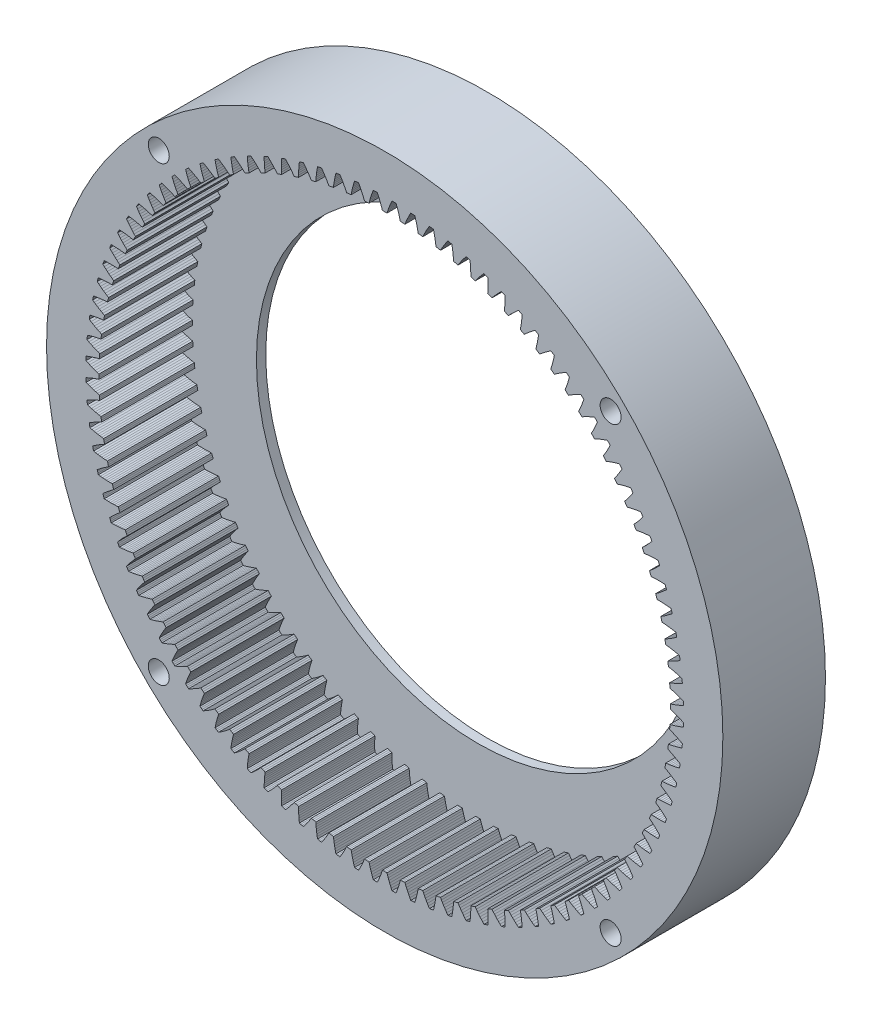
from build123d import *

# Parameters (mm, degrees)
INTERNAL_RING_TEETH_START = 35
SKETCH_1_R                = 72.5
INTERNAL_RING_TEETH_DEPTH = 20
RING_BACK_FLANGE_START    = 33
SKETCH_2_R                = 72.5
SKETCH_2_R_2              = 47.5
RING_BACK_FLANGE_DEPTH    = 2
SKETCH_3_R                = 2.25
THROUGH_HOLES_DEPTH       = 100


with BuildPart() as part:
    # Эскиз1 → Internal_ring_teeth (new body)
    with BuildSketch(Plane.XY.offset(INTERNAL_RING_TEETH_START)):
        Circle(SKETCH_1_R)
        Polygon((64.04305432, -1.578321768), (63.645374415, -1.397447308), (63.247071369, -1.224747848), (62.84819671, -1.060461443), (62.448801879, -0.904864473), (62.048938227, -0.758282244), (61.648657013, -0.62110406), (61.248009405, -0.493805503), (61.249778822, -0.164603419), (61.249778822, 0.164603419), (61.248009405, 0.493805503), (61.648657013, 0.62110406), (62.048938227, 0.758282244), (62.448801879, 0.904864473), (62.84819671, 1.060461443), (63.247071369, 1.224747848), (63.645374415, 1.397447308), (64.04305432, 1.578321768), (64.035270831, 1.867617707), (64.026180537, 2.156875533), (64.015783625, 2.446089343), (63.607531249, 2.60163636), (63.199170274, 2.748985382), (62.790767075, 2.887902058), (62.382390344, 3.018113784), (61.974111757, 3.13929912), (61.566006917, 3.251072749), (61.158156754, 3.35296324), (61.139251909, 3.681626821), (61.11858084, 4.010184045), (61.096144146, 4.338625422), (61.488008024, 4.490829656), (61.878885885, 4.652871015), (62.268756523, 4.824271644), (62.657593225, 5.004639788), (63.045365167, 5.193647558), (63.432038364, 5.39101589), (63.817576338, 5.596503963), (63.791643165, 5.884740314), (63.76440816, 6.172856571), (63.735871879, 6.460846856), (63.318658217, 6.590452558), (62.901850928, 6.711869623), (62.485530969, 6.824868329), (62.069784014, 6.929180925), (61.654701781, 7.024491105), (61.240383919, 7.110419059), (60.826940798, 7.186499369), (60.7874363, 7.513327363), (60.746175743, 7.839938307), (60.703160317, 8.166322767), (61.084693959, 8.342831998), (61.46462585, 8.529097029), (61.842964833, 8.724639618), (62.219708845, 8.929067105), (62.594847712, 9.142050313), (62.968365038, 9.363308595), (63.340239537, 9.592599315), (63.296259027, 9.878638539), (63.250986795, 10.164476165), (63.204423764, 10.450106358), (62.779895369, 10.553259251), (62.356286713, 10.64826518), (61.933693019, 10.734899963), (61.512216604, 10.812901755), (61.091968865, 10.881960633), (60.673073104, 10.941703794), (60.255668696, 10.991673668), (60.195720452, 11.315376233), (60.134033241, 11.638751914), (60.070608847, 11.961791368), (60.440306513, 12.161908993), (60.807793018, 12.371662594), (61.173107215, 12.590575426), (61.5362717, 12.818255475), (61.89729699, 13.054373573), (62.256184342, 13.298648599), (62.612927749, 13.550837059), (62.551073473, 13.833550291), (62.487942682, 14.115981215), (62.423536664, 14.398124065), (61.993368955, 14.474417051), (61.564630722, 14.5426369), (61.137431077, 14.602565851), (60.711888576, 14.653949001), (60.288133858, 14.696484033), (59.866313388, 14.729806622), (59.446594998, 14.753468853), (59.366439595, 15.072768484), (59.284569184, 15.391632684), (59.200986128, 15.710052243), (59.55738879, 15.932988491), (59.910979607, 16.165402859), (60.261827289, 16.406821985), (60.609979004, 16.656856045), (60.955465914, 16.915177184), (61.298306928, 17.181504913), (61.638511339, 17.45559584), (61.559027408, 17.73386734), (61.478287207, 18.011776936), (61.396292383, 18.289318954), (60.962183036, 18.338450939), (60.530007261, 18.379615476), (60.099887626, 18.412602083), (59.671958462, 18.437163805), (59.24636913, 18.453007126), (58.823288683, 18.459777633), (58.402912748, 18.457038836), (58.302866524, 18.770675403), (58.201136016, 19.083769712), (58.097724163, 19.396312719), (58.439425263, 19.641187761), (58.77772493, 19.895345664), (59.112721462, 20.158318313), (59.444486411, 20.429719615), (59.773071463, 20.709224319), (60.098513102, 20.996553676), (60.420835886, 21.291465359), (60.324035986, 21.564196917), (60.226005019, 21.836488402), (60.126744986, 22.108334257), (59.690407232, 22.13011134), (59.256499514, 22.144058106), (58.825157376, 22.149972187), (58.396530389, 22.147615547), (57.97078605, 22.136704629), (57.548115332, 22.116896336), (57.128740883, 22.08776732), (57.009198674, 22.394503042), (56.888009554, 22.70059182), (56.765177023, 23.006024811), (57.090828023, 23.271872237), (57.412501426, 23.546770629), (57.73032473, 23.830258968), (58.044393587, 24.121956415), (58.354780006, 24.421541606), (58.661537901, 24.728738634), (58.964706996, 25.043307191), (58.850973153, 25.309422459), (58.736038304, 25.575021224), (58.619904796, 25.840098065), (58.18306066, 25.834434301), (57.749133435, 25.821108256), (57.318271104, 25.799926469), (56.890637889, 25.770660769), (56.466418761, 25.733038673), (56.04582586, 25.686729753), (55.629107977, 25.631325476), (55.490541563, 25.929949808), (55.350372108, 26.227825062), (55.208603662, 26.524942632), (55.516919367, 26.810713265), (55.820697008, 27.105267248), (56.12009278, 27.408152477), (56.41522606, 27.718994873), (56.706188893, 28.037478226), (56.99305241, 28.363330558), (57.275871347, 28.696314531), (57.145652415, 28.954763275), (57.01426728, 29.212621122), (56.881718622, 29.469882811), (56.446092129, 29.436800553), (56.013857909, 29.396254288), (55.585175802, 29.348060229), (55.160224032, 29.292000966), (54.739204315, 29.227816169), (54.322349119, 29.155189382), (53.909932397, 29.073728501), (53.752888635, 29.363062909), (53.594292031, 29.651549061), (53.434147166, 29.939178624), (53.723910793, 30.243744657), (54.008593801, 30.556791761), (54.288380463, 30.877878531), (54.563413409, 31.206639122), (54.833804358, 31.542763728), (55.099641378, 31.885985375), (55.360994, 32.236070628), (55.214803895, 32.485832867), (55.06748699, 32.73493215), (54.919046291, 32.983363393), (54.48635666, 32.922993201), (54.057521277, 32.855386734), (53.632711206, 32.780370603), (53.212117971, 32.697739017), (52.795959237, 32.607244828), (52.384486884, 32.508586799), (51.977998943, 32.401390802), (51.803097613, 32.680293416), (51.626699767, 32.958251943), (51.448810502, 33.235258355), (51.718878488, 33.557417805), (51.983343348, 33.887722576), (52.24241671, 34.225743705), (52.496263893, 34.571125024), (52.745015849, 34.923564353), (52.988777235, 35.282800774), (53.227632103, 35.648605681), (53.066047769, 35.888695719), (52.903380487, 36.128053357), (52.739633575, 36.366673708), (52.311588433, 36.279253837), (51.887844304, 36.184853978), (51.468582801, 36.08331183), (51.054007991, 35.974434031), (50.644352629, 35.857987588), (50.239887011, 35.733687676), (49.840932073, 35.601179617), (49.648863431, 35.868549734), (49.455360506, 36.134883661), (49.260428888, 36.400173705), (49.509735397, 36.738655156), (49.752938388, 37.084914032), (49.990276006, 37.438535504), (50.221935607, 37.799174489), (50.448066859, 38.166537624), (50.668790596, 38.540371079), (50.884205058, 38.920451974), (50.707864196, 39.149922285), (50.53048851, 39.378593642), (50.35208162, 39.606461377), (49.930370267, 39.492336832), (49.513389716, 39.371516136), (49.101331414, 39.24384871), (48.694411166, 39.109154389), (48.292875897, 38.967215253), (47.897013256, 38.817764012), (47.507165815, 38.66046684), (47.298687868, 38.915249273), (47.088843531, 39.168907502), (46.877638867, 39.421434199), (47.1052, 39.77490182), (47.326181311, 40.135748275), (47.54084652, 40.503574508), (47.749404285, 40.878047881), (47.952022397, 41.258885008), (48.148837389, 41.645840145), (48.339961303, 42.038697024), (48.149559849, 42.256641993), (47.95817578, 42.473724608), (47.765813002, 42.689940437), (47.352099739, 42.549561615), (46.943528399, 42.402796906), (46.540299504, 42.249508048), (46.142639746, 42.089528782), (45.750809248, 41.922657123), (45.365111872, 41.748644368), (44.985910477, 41.567178863), (44.761845992, 41.808368102), (44.536488403, 42.04834956), (44.30984422, 42.287116302), (44.514761898, 42.654175117), (44.712649417, 43.028185056), (44.903795033, 43.408764408), (45.08842788, 43.795594293), (45.266733209, 44.188402421), (45.438862718, 44.586952107), (45.604941805, 44.991034542), (45.401231187, 45.196594041), (45.196594041, 45.401231187), (44.991034542, 45.604941805), (44.586952107, 45.438862718), (44.188402421, 45.266733209), (43.795594293, 45.08842788), (43.408764408, 44.903795033), (43.028185056, 44.712649417), (42.654175117, 44.514761898), (42.287116302, 44.30984422), (42.04834956, 44.536488403), (41.808368102, 44.761845992), (41.567178863, 44.985910477), (41.748644368, 45.365111872), (41.922657123, 45.750809248), (42.089528782, 46.142639746), (42.249508048, 46.540299504), (42.402796906, 46.943528399), (42.549561615, 47.352099739), (42.689940437, 47.765813002), (42.473724608, 47.95817578), (42.256641993, 48.149559849), (42.038697024, 48.339961303), (41.645840145, 48.148837389), (41.258885008, 47.952022397), (40.878047881, 47.749404285), (40.503574508, 47.54084652), (40.135748275, 47.326181311), (39.77490182, 47.1052), (39.421434199, 46.877638867), (39.168907502, 47.088843531), (38.915249273, 47.298687868), (38.66046684, 47.507165815), (38.817764012, 47.897013256), (38.967215253, 48.292875897), (39.109154389, 48.694411166), (39.24384871, 49.101331414), (39.371516136, 49.513389716), (39.492336832, 49.930370267), (39.606461377, 50.35208162), (39.378593642, 50.53048851), (39.149922285, 50.707864196), (38.920451974, 50.884205058), (38.540371079, 50.668790596), (38.166537624, 50.448066859), (37.799174489, 50.221935607), (37.438535504, 49.990276006), (37.084914032, 49.752938388), (36.738655156, 49.509735397), (36.400173705, 49.260428888), (36.134883661, 49.455360506), (35.868549734, 49.648863431), (35.601179617, 49.840932073), (35.733687676, 50.239887011), (35.857987588, 50.644352629), (35.974434031, 51.054007991), (36.08331183, 51.468582801), (36.184853978, 51.887844304), (36.279253837, 52.311588433), (36.366673708, 52.739633575), (36.128053357, 52.903380487), (35.888695719, 53.066047769), (35.648605681, 53.227632103), (35.282800774, 52.988777235), (34.923564353, 52.745015849), (34.571125024, 52.496263893), (34.225743705, 52.24241671), (33.887722576, 51.983343348), (33.557417805, 51.718878488), (33.235258355, 51.448810502), (32.958251943, 51.626699767), (32.680293416, 51.803097613), (32.401390802, 51.977998943), (32.508586799, 52.384486884), (32.607244828, 52.795959237), (32.697739017, 53.212117971), (32.780370603, 53.632711206), (32.855386734, 54.057521277), (32.922993201, 54.48635666), (32.983363393, 54.919046291), (32.73493215, 55.06748699), (32.485832867, 55.214803895), (32.236070628, 55.360994), (31.885985375, 55.099641378), (31.542763728, 54.833804358), (31.206639122, 54.563413409), (30.877878531, 54.288380463), (30.556791761, 54.008593801), (30.243744657, 53.723910793), (29.939178624, 53.434147166), (29.651549061, 53.594292031), (29.363062909, 53.752888635), (29.073728501, 53.909932397), (29.155189382, 54.322349119), (29.227816169, 54.739204315), (29.292000966, 55.160224032), (29.348060229, 55.585175802), (29.396254288, 56.013857909), (29.436800553, 56.446092129), (29.469882811, 56.881718622), (29.212621122, 57.01426728), (28.954763275, 57.145652415), (28.696314531, 57.275871347), (28.363330558, 56.99305241), (28.037478226, 56.706188893), (27.718994873, 56.41522606), (27.408152477, 56.12009278), (27.105267248, 55.820697008), (26.810713265, 55.516919367), (26.524942632, 55.208603662), (26.227825062, 55.350372108), (25.929949808, 55.490541563), (25.631325476, 55.629107977), (25.686729753, 56.04582586), (25.733038673, 56.466418761), (25.770660769, 56.890637889), (25.799926469, 57.318271104), (25.821108256, 57.749133435), (25.834434301, 58.18306066), (25.840098065, 58.619904796), (25.575021224, 58.736038304), (25.309422459, 58.850973153), (25.043307191, 58.964706996), (24.728738634, 58.661537901), (24.421541606, 58.354780006), (24.121956415, 58.044393587), (23.830258968, 57.73032473), (23.546770629, 57.412501426), (23.271872237, 57.090828023), (23.006024811, 56.765177023), (22.70059182, 56.888009554), (22.394503042, 57.009198674), (22.08776732, 57.128740883), (22.116896336, 57.548115332), (22.136704629, 57.97078605), (22.147615547, 58.396530389), (22.149972187, 58.825157376), (22.144058106, 59.256499514), (22.13011134, 59.690407232), (22.108334257, 60.126744986), (21.836488402, 60.226005019), (21.564196917, 60.324035986), (21.291465359, 60.420835886), (20.996553676, 60.098513102), (20.709224319, 59.773071463), (20.429719615, 59.444486411), (20.158318313, 59.112721462), (19.895345664, 58.77772493), (19.641187761, 58.439425263), (19.396312719, 58.097724163), (19.083769712, 58.201136016), (18.770675403, 58.302866524), (18.457038836, 58.402912748), (18.459777633, 58.823288683), (18.453007126, 59.24636913), (18.437163805, 59.671958462), (18.412602083, 60.099887626), (18.379615476, 60.530007261), (18.338450939, 60.962183036), (18.289318954, 61.396292383), (18.011776936, 61.478287207), (17.73386734, 61.559027408), (17.45559584, 61.638511339), (17.181504913, 61.298306928), (16.915177184, 60.955465914), (16.656856045, 60.609979004), (16.406821985, 60.261827289), (16.165402859, 59.910979607), (15.932988491, 59.55738879), (15.710052243, 59.200986128), (15.391632684, 59.284569184), (15.072768484, 59.366439595), (14.753468853, 59.446594998), (14.729806622, 59.866313388), (14.696484033, 60.288133858), (14.653949001, 60.711888576), (14.602565851, 61.137431077), (14.5426369, 61.564630722), (14.474417051, 61.993368955), (14.398124065, 62.423536664), (14.115981215, 62.487942682), (13.833550291, 62.551073473), (13.550837059, 62.612927749), (13.298648599, 62.256184342), (13.054373573, 61.89729699), (12.818255475, 61.5362717), (12.590575426, 61.173107215), (12.371662594, 60.807793018), (12.161908993, 60.440306513), (11.961791368, 60.070608847), (11.638751914, 60.134033241), (11.315376233, 60.195720452), (10.991673668, 60.255668696), (10.941703794, 60.673073104), (10.881960633, 61.091968865), (10.812901755, 61.512216604), (10.734899963, 61.933693019), (10.64826518, 62.356286713), (10.553259251, 62.779895369), (10.450106358, 63.204423764), (10.164476165, 63.250986795), (9.878638539, 63.296259027), (9.592599315, 63.340239537), (9.363308595, 62.968365038), (9.142050313, 62.594847712), (8.929067105, 62.219708845), (8.724639618, 61.842964833), (8.529097029, 61.46462585), (8.342831998, 61.084693959), (8.166322767, 60.703160317), (7.839938307, 60.746175743), (7.513327363, 60.7874363), (7.186499369, 60.826940798), (7.110419059, 61.240383919), (7.024491105, 61.654701781), (6.929180925, 62.069784014), (6.824868329, 62.485530969), (6.711869623, 62.901850928), (6.590452558, 63.318658217), (6.460846856, 63.735871879), (6.172856571, 63.76440816), (5.884740314, 63.791643165), (5.596503963, 63.817576338), (5.39101589, 63.432038364), (5.193647558, 63.045365167), (5.004639788, 62.657593225), (4.824271644, 62.268756523), (4.652871015, 61.878885885), (4.490829656, 61.488008024), (4.338625422, 61.096144146), (4.010184045, 61.11858084), (3.681626821, 61.139251909), (3.35296324, 61.158156754), (3.251072749, 61.566006917), (3.13929912, 61.974111757), (3.018113784, 62.382390344), (2.887902058, 62.790767075), (2.748985382, 63.199170274), (2.60163636, 63.607531249), (2.446089343, 64.015783625), (2.156875533, 64.026180537), (1.867617707, 64.035270831), (1.578321768, 64.04305432), (1.397447308, 63.645374415), (1.224747848, 63.247071369), (1.060461443, 62.84819671), (0.904864473, 62.448801879), (0.758282244, 62.048938227), (0.62110406, 61.648657013), (0.493805503, 61.248009405), (0.164603419, 61.249778822), (-0.164603419, 61.249778822), (-0.493805503, 61.248009405), (-0.62110406, 61.648657013), (-0.758282244, 62.048938227), (-0.904864473, 62.448801879), (-1.060461443, 62.84819671), (-1.224747848, 63.247071369), (-1.397447308, 63.645374415), (-1.578321768, 64.04305432), (-1.867617707, 64.035270831), (-2.156875533, 64.026180537), (-2.446089343, 64.015783625), (-2.60163636, 63.607531249), (-2.748985382, 63.199170274), (-2.887902058, 62.790767075), (-3.018113784, 62.382390344), (-3.13929912, 61.974111757), (-3.251072749, 61.566006917), (-3.35296324, 61.158156754), (-3.681626821, 61.139251909), (-4.010184045, 61.11858084), (-4.338625422, 61.096144146), (-4.490829656, 61.488008024), (-4.652871015, 61.878885885), (-4.824271644, 62.268756523), (-5.004639788, 62.657593225), (-5.193647558, 63.045365167), (-5.39101589, 63.432038364), (-5.596503963, 63.817576338), (-5.884740314, 63.791643165), (-6.172856571, 63.76440816), (-6.460846856, 63.735871879), (-6.590452558, 63.318658217), (-6.711869623, 62.901850928), (-6.824868329, 62.485530969), (-6.929180925, 62.069784014), (-7.024491105, 61.654701781), (-7.110419059, 61.240383919), (-7.186499369, 60.826940798), (-7.513327363, 60.7874363), (-7.839938307, 60.746175743), (-8.166322767, 60.703160317), (-8.342831998, 61.084693959), (-8.529097029, 61.46462585), (-8.724639618, 61.842964833), (-8.929067105, 62.219708845), (-9.142050313, 62.594847712), (-9.363308595, 62.968365038), (-9.592599315, 63.340239537), (-9.878638539, 63.296259027), (-10.164476165, 63.250986795), (-10.450106358, 63.204423764), (-10.553259251, 62.779895369), (-10.64826518, 62.356286713), (-10.734899963, 61.933693019), (-10.812901755, 61.512216604), (-10.881960633, 61.091968865), (-10.941703794, 60.673073104), (-10.991673668, 60.255668696), (-11.315376233, 60.195720452), (-11.638751914, 60.134033241), (-11.961791368, 60.070608847), (-12.161908993, 60.440306513), (-12.371662594, 60.807793018), (-12.590575426, 61.173107215), (-12.818255475, 61.5362717), (-13.054373573, 61.89729699), (-13.298648599, 62.256184342), (-13.550837059, 62.612927749), (-13.833550291, 62.551073473), (-14.115981215, 62.487942682), (-14.398124065, 62.423536664), (-14.474417051, 61.993368955), (-14.5426369, 61.564630722), (-14.602565851, 61.137431077), (-14.653949001, 60.711888576), (-14.696484033, 60.288133858), (-14.729806622, 59.866313388), (-14.753468853, 59.446594998), (-15.072768484, 59.366439595), (-15.391632684, 59.284569184), (-15.710052243, 59.200986128), (-15.932988491, 59.55738879), (-16.165402859, 59.910979607), (-16.406821985, 60.261827289), (-16.656856045, 60.609979004), (-16.915177184, 60.955465914), (-17.181504913, 61.298306928), (-17.45559584, 61.638511339), (-17.73386734, 61.559027408), (-18.011776936, 61.478287207), (-18.289318954, 61.396292383), (-18.338450939, 60.962183036), (-18.379615476, 60.530007261), (-18.412602083, 60.099887626), (-18.437163805, 59.671958462), (-18.453007126, 59.24636913), (-18.459777633, 58.823288683), (-18.457038836, 58.402912748), (-18.770675403, 58.302866524), (-19.083769712, 58.201136016), (-19.396312719, 58.097724163), (-19.641187761, 58.439425263), (-19.895345664, 58.77772493), (-20.158318313, 59.112721462), (-20.429719615, 59.444486411), (-20.709224319, 59.773071463), (-20.996553676, 60.098513102), (-21.291465359, 60.420835886), (-21.564196917, 60.324035986), (-21.836488402, 60.226005019), (-22.108334257, 60.126744986), (-22.13011134, 59.690407232), (-22.144058106, 59.256499514), (-22.149972187, 58.825157376), (-22.147615547, 58.396530389), (-22.136704629, 57.97078605), (-22.116896336, 57.548115332), (-22.08776732, 57.128740883), (-22.394503042, 57.009198674), (-22.70059182, 56.888009554), (-23.006024811, 56.765177023), (-23.271872237, 57.090828023), (-23.546770629, 57.412501426), (-23.830258968, 57.73032473), (-24.121956415, 58.044393587), (-24.421541606, 58.354780006), (-24.728738634, 58.661537901), (-25.043307191, 58.964706996), (-25.309422459, 58.850973153), (-25.575021224, 58.736038304), (-25.840098065, 58.619904796), (-25.834434301, 58.18306066), (-25.821108256, 57.749133435), (-25.799926469, 57.318271104), (-25.770660769, 56.890637889), (-25.733038673, 56.466418761), (-25.686729753, 56.04582586), (-25.631325476, 55.629107977), (-25.929949808, 55.490541563), (-26.227825062, 55.350372108), (-26.524942632, 55.208603662), (-26.810713265, 55.516919367), (-27.105267248, 55.820697008), (-27.408152477, 56.12009278), (-27.718994873, 56.41522606), (-28.037478226, 56.706188893), (-28.363330558, 56.99305241), (-28.696314531, 57.275871347), (-28.954763275, 57.145652415), (-29.212621122, 57.01426728), (-29.469882811, 56.881718622), (-29.436800553, 56.446092129), (-29.396254288, 56.013857909), (-29.348060229, 55.585175802), (-29.292000966, 55.160224032), (-29.227816169, 54.739204315), (-29.155189382, 54.322349119), (-29.073728501, 53.909932397), (-29.363062909, 53.752888635), (-29.651549061, 53.594292031), (-29.939178624, 53.434147166), (-30.243744657, 53.723910793), (-30.556791761, 54.008593801), (-30.877878531, 54.288380463), (-31.206639122, 54.563413409), (-31.542763728, 54.833804358), (-31.885985375, 55.099641378), (-32.236070628, 55.360994), (-32.485832867, 55.214803895), (-32.73493215, 55.06748699), (-32.983363393, 54.919046291), (-32.922993201, 54.48635666), (-32.855386734, 54.057521277), (-32.780370603, 53.632711206), (-32.697739017, 53.212117971), (-32.607244828, 52.795959237), (-32.508586799, 52.384486884), (-32.401390802, 51.977998943), (-32.680293416, 51.803097613), (-32.958251943, 51.626699767), (-33.235258355, 51.448810502), (-33.557417805, 51.718878488), (-33.887722576, 51.983343348), (-34.225743705, 52.24241671), (-34.571125024, 52.496263893), (-34.923564353, 52.745015849), (-35.282800774, 52.988777235), (-35.648605681, 53.227632103), (-35.888695719, 53.066047769), (-36.128053357, 52.903380487), (-36.366673708, 52.739633575), (-36.279253837, 52.311588433), (-36.184853978, 51.887844304), (-36.08331183, 51.468582801), (-35.974434031, 51.054007991), (-35.857987588, 50.644352629), (-35.733687676, 50.239887011), (-35.601179617, 49.840932073), (-35.868549734, 49.648863431), (-36.134883661, 49.455360506), (-36.400173705, 49.260428888), (-36.738655156, 49.509735397), (-37.084914032, 49.752938388), (-37.438535504, 49.990276006), (-37.799174489, 50.221935607), (-38.166537624, 50.448066859), (-38.540371079, 50.668790596), (-38.920451974, 50.884205058), (-39.149922285, 50.707864196), (-39.378593642, 50.53048851), (-39.606461377, 50.35208162), (-39.492336832, 49.930370267), (-39.371516136, 49.513389716), (-39.24384871, 49.101331414), (-39.109154389, 48.694411166), (-38.967215253, 48.292875897), (-38.817764012, 47.897013256), (-38.66046684, 47.507165815), (-38.915249273, 47.298687868), (-39.168907502, 47.088843531), (-39.421434199, 46.877638867), (-39.77490182, 47.1052), (-40.135748275, 47.326181311), (-40.503574508, 47.54084652), (-40.878047881, 47.749404285), (-41.258885008, 47.952022397), (-41.645840145, 48.148837389), (-42.038697024, 48.339961303), (-42.256641993, 48.149559849), (-42.473724608, 47.95817578), (-42.689940437, 47.765813002), (-42.549561615, 47.352099739), (-42.402796906, 46.943528399), (-42.249508048, 46.540299504), (-42.089528782, 46.142639746), (-41.922657123, 45.750809248), (-41.748644368, 45.365111872), (-41.567178863, 44.985910477), (-41.808368102, 44.761845992), (-42.04834956, 44.536488403), (-42.287116302, 44.30984422), (-42.654175117, 44.514761898), (-43.028185056, 44.712649417), (-43.408764408, 44.903795033), (-43.795594293, 45.08842788), (-44.188402421, 45.266733209), (-44.586952107, 45.438862718), (-44.991034542, 45.604941805), (-45.196594041, 45.401231187), (-45.401231187, 45.196594041), (-45.604941805, 44.991034542), (-45.438862718, 44.586952107), (-45.266733209, 44.188402421), (-45.08842788, 43.795594293), (-44.903795033, 43.408764408), (-44.712649417, 43.028185056), (-44.514761898, 42.654175117), (-44.30984422, 42.287116302), (-44.536488403, 42.04834956), (-44.761845992, 41.808368102), (-44.985910477, 41.567178863), (-45.365111872, 41.748644368), (-45.750809248, 41.922657123), (-46.142639746, 42.089528782), (-46.540299504, 42.249508048), (-46.943528399, 42.402796906), (-47.352099739, 42.549561615), (-47.765813002, 42.689940437), (-47.95817578, 42.473724608), (-48.149559849, 42.256641993), (-48.339961303, 42.038697024), (-48.148837389, 41.645840145), (-47.952022397, 41.258885008), (-47.749404285, 40.878047881), (-47.54084652, 40.503574508), (-47.326181311, 40.135748275), (-47.1052, 39.77490182), (-46.877638867, 39.421434199), (-47.088843531, 39.168907502), (-47.298687868, 38.915249273), (-47.507165815, 38.66046684), (-47.897013256, 38.817764012), (-48.292875897, 38.967215253), (-48.694411166, 39.109154389), (-49.101331414, 39.24384871), (-49.513389716, 39.371516136), (-49.930370267, 39.492336832), (-50.35208162, 39.606461377), (-50.53048851, 39.378593642), (-50.707864196, 39.149922285), (-50.884205058, 38.920451974), (-50.668790596, 38.540371079), (-50.448066859, 38.166537624), (-50.221935607, 37.799174489), (-49.990276006, 37.438535504), (-49.752938388, 37.084914032), (-49.509735397, 36.738655156), (-49.260428888, 36.400173705), (-49.455360506, 36.134883661), (-49.648863431, 35.868549734), (-49.840932073, 35.601179617), (-50.239887011, 35.733687676), (-50.644352629, 35.857987588), (-51.054007991, 35.974434031), (-51.468582801, 36.08331183), (-51.887844304, 36.184853978), (-52.311588433, 36.279253837), (-52.739633575, 36.366673708), (-52.903380487, 36.128053357), (-53.066047769, 35.888695719), (-53.227632103, 35.648605681), (-52.988777235, 35.282800774), (-52.745015849, 34.923564353), (-52.496263893, 34.571125024), (-52.24241671, 34.225743705), (-51.983343348, 33.887722576), (-51.718878488, 33.557417805), (-51.448810502, 33.235258355), (-51.626699767, 32.958251943), (-51.803097613, 32.680293416), (-51.977998943, 32.401390802), (-52.384486884, 32.508586799), (-52.795959237, 32.607244828), (-53.212117971, 32.697739017), (-53.632711206, 32.780370603), (-54.057521277, 32.855386734), (-54.48635666, 32.922993201), (-54.919046291, 32.983363393), (-55.06748699, 32.73493215), (-55.214803895, 32.485832867), (-55.360994, 32.236070628), (-55.099641378, 31.885985375), (-54.833804358, 31.542763728), (-54.563413409, 31.206639122), (-54.288380463, 30.877878531), (-54.008593801, 30.556791761), (-53.723910793, 30.243744657), (-53.434147166, 29.939178624), (-53.594292031, 29.651549061), (-53.752888635, 29.363062909), (-53.909932397, 29.073728501), (-54.322349119, 29.155189382), (-54.739204315, 29.227816169), (-55.160224032, 29.292000966), (-55.585175802, 29.348060229), (-56.013857909, 29.396254288), (-56.446092129, 29.436800553), (-56.881718622, 29.469882811), (-57.01426728, 29.212621122), (-57.145652415, 28.954763275), (-57.275871347, 28.696314531), (-56.99305241, 28.363330558), (-56.706188893, 28.037478226), (-56.41522606, 27.718994873), (-56.12009278, 27.408152477), (-55.820697008, 27.105267248), (-55.516919367, 26.810713265), (-55.208603662, 26.524942632), (-55.350372108, 26.227825062), (-55.490541563, 25.929949808), (-55.629107977, 25.631325476), (-56.04582586, 25.686729753), (-56.466418761, 25.733038673), (-56.890637889, 25.770660769), (-57.318271104, 25.799926469), (-57.749133435, 25.821108256), (-58.18306066, 25.834434301), (-58.619904796, 25.840098065), (-58.736038304, 25.575021224), (-58.850973153, 25.309422459), (-58.964706996, 25.043307191), (-58.661537901, 24.728738634), (-58.354780006, 24.421541606), (-58.044393587, 24.121956415), (-57.73032473, 23.830258968), (-57.412501426, 23.546770629), (-57.090828023, 23.271872237), (-56.765177023, 23.006024811), (-56.888009554, 22.70059182), (-57.009198674, 22.394503042), (-57.128740883, 22.08776732), (-57.548115332, 22.116896336), (-57.97078605, 22.136704629), (-58.396530389, 22.147615547), (-58.825157376, 22.149972187), (-59.256499514, 22.144058106), (-59.690407232, 22.13011134), (-60.126744986, 22.108334257), (-60.226005019, 21.836488402), (-60.324035986, 21.564196917), (-60.420835886, 21.291465359), (-60.098513102, 20.996553676), (-59.773071463, 20.709224319), (-59.444486411, 20.429719615), (-59.112721462, 20.158318313), (-58.77772493, 19.895345664), (-58.439425263, 19.641187761), (-58.097724163, 19.396312719), (-58.201136016, 19.083769712), (-58.302866524, 18.770675403), (-58.402912748, 18.457038836), (-58.823288683, 18.459777633), (-59.24636913, 18.453007126), (-59.671958462, 18.437163805), (-60.099887626, 18.412602083), (-60.530007261, 18.379615476), (-60.962183036, 18.338450939), (-61.396292383, 18.289318954), (-61.478287207, 18.011776936), (-61.559027408, 17.73386734), (-61.638511339, 17.45559584), (-61.298306928, 17.181504913), (-60.955465914, 16.915177184), (-60.609979004, 16.656856045), (-60.261827289, 16.406821985), (-59.910979607, 16.165402859), (-59.55738879, 15.932988491), (-59.200986128, 15.710052243), (-59.284569184, 15.391632684), (-59.366439595, 15.072768484), (-59.446594998, 14.753468853), (-59.866313388, 14.729806622), (-60.288133858, 14.696484033), (-60.711888576, 14.653949001), (-61.137431077, 14.602565851), (-61.564630722, 14.5426369), (-61.993368955, 14.474417051), (-62.423536664, 14.398124065), (-62.487942682, 14.115981215), (-62.551073473, 13.833550291), (-62.612927749, 13.550837059), (-62.256184342, 13.298648599), (-61.89729699, 13.054373573), (-61.5362717, 12.818255475), (-61.173107215, 12.590575426), (-60.807793018, 12.371662594), (-60.440306513, 12.161908993), (-60.070608847, 11.961791368), (-60.134033241, 11.638751914), (-60.195720452, 11.315376233), (-60.255668696, 10.991673668), (-60.673073104, 10.941703794), (-61.091968865, 10.881960633), (-61.512216604, 10.812901755), (-61.933693019, 10.734899963), (-62.356286713, 10.64826518), (-62.779895369, 10.553259251), (-63.204423764, 10.450106358), (-63.250986795, 10.164476165), (-63.296259027, 9.878638539), (-63.340239537, 9.592599315), (-62.968365038, 9.363308595), (-62.594847712, 9.142050313), (-62.219708845, 8.929067105), (-61.842964833, 8.724639618), (-61.46462585, 8.529097029), (-61.084693959, 8.342831998), (-60.703160317, 8.166322767), (-60.746175743, 7.839938307), (-60.7874363, 7.513327363), (-60.826940798, 7.186499369), (-61.240383919, 7.110419059), (-61.654701781, 7.024491105), (-62.069784014, 6.929180925), (-62.485530969, 6.824868329), (-62.901850928, 6.711869623), (-63.318658217, 6.590452558), (-63.735871879, 6.460846856), (-63.76440816, 6.172856571), (-63.791643165, 5.884740314), (-63.817576338, 5.596503963), (-63.432038364, 5.39101589), (-63.045365167, 5.193647558), (-62.657593225, 5.004639788), (-62.268756523, 4.824271644), (-61.878885885, 4.652871015), (-61.488008024, 4.490829656), (-61.096144146, 4.338625422), (-61.11858084, 4.010184045), (-61.139251909, 3.681626821), (-61.158156754, 3.35296324), (-61.566006917, 3.251072749), (-61.974111757, 3.13929912), (-62.382390344, 3.018113784), (-62.790767075, 2.887902058), (-63.199170274, 2.748985382), (-63.607531249, 2.60163636), (-64.015783625, 2.446089343), (-64.026180537, 2.156875533), (-64.035270831, 1.867617707), (-64.04305432, 1.578321768), (-63.645374415, 1.397447308), (-63.247071369, 1.224747848), (-62.84819671, 1.060461443), (-62.448801879, 0.904864473), (-62.048938227, 0.758282244), (-61.648657013, 0.62110406), (-61.248009405, 0.493805503), (-61.249778822, 0.164603419), (-61.249778822, -0.164603419), (-61.248009405, -0.493805503), (-61.648657013, -0.62110406), (-62.048938227, -0.758282244), (-62.448801879, -0.904864473), (-62.84819671, -1.060461443), (-63.247071369, -1.224747848), (-63.645374415, -1.397447308), (-64.04305432, -1.578321768), (-64.035270831, -1.867617707), (-64.026180537, -2.156875533), (-64.015783625, -2.446089343), (-63.607531249, -2.60163636), (-63.199170274, -2.748985382), (-62.790767075, -2.887902058), (-62.382390344, -3.018113784), (-61.974111757, -3.13929912), (-61.566006917, -3.251072749), (-61.158156754, -3.35296324), (-61.139251909, -3.681626821), (-61.11858084, -4.010184045), (-61.096144146, -4.338625422), (-61.488008024, -4.490829656), (-61.878885885, -4.652871015), (-62.268756523, -4.824271644), (-62.657593225, -5.004639788), (-63.045365167, -5.193647558), (-63.432038364, -5.39101589), (-63.817576338, -5.596503963), (-63.791643165, -5.884740314), (-63.76440816, -6.172856571), (-63.735871879, -6.460846856), (-63.318658217, -6.590452558), (-62.901850928, -6.711869623), (-62.485530969, -6.824868329), (-62.069784014, -6.929180925), (-61.654701781, -7.024491105), (-61.240383919, -7.110419059), (-60.826940798, -7.186499369), (-60.7874363, -7.513327363), (-60.746175743, -7.839938307), (-60.703160317, -8.166322767), (-61.084693959, -8.342831998), (-61.46462585, -8.529097029), (-61.842964833, -8.724639618), (-62.219708845, -8.929067105), (-62.594847712, -9.142050313), (-62.968365038, -9.363308595), (-63.340239537, -9.592599315), (-63.296259027, -9.878638539), (-63.250986795, -10.164476165), (-63.204423764, -10.450106358), (-62.779895369, -10.553259251), (-62.356286713, -10.64826518), (-61.933693019, -10.734899963), (-61.512216604, -10.812901755), (-61.091968865, -10.881960633), (-60.673073104, -10.941703794), (-60.255668696, -10.991673668), (-60.195720452, -11.315376233), (-60.134033241, -11.638751914), (-60.070608847, -11.961791368), (-60.440306513, -12.161908993), (-60.807793018, -12.371662594), (-61.173107215, -12.590575426), (-61.5362717, -12.818255475), (-61.89729699, -13.054373573), (-62.256184342, -13.298648599), (-62.612927749, -13.550837059), (-62.551073473, -13.833550291), (-62.487942682, -14.115981215), (-62.423536664, -14.398124065), (-61.993368955, -14.474417051), (-61.564630722, -14.5426369), (-61.137431077, -14.602565851), (-60.711888576, -14.653949001), (-60.288133858, -14.696484033), (-59.866313388, -14.729806622), (-59.446594998, -14.753468853), (-59.366439595, -15.072768484), (-59.284569184, -15.391632684), (-59.200986128, -15.710052243), (-59.55738879, -15.932988491), (-59.910979607, -16.165402859), (-60.261827289, -16.406821985), (-60.609979004, -16.656856045), (-60.955465914, -16.915177184), (-61.298306928, -17.181504913), (-61.638511339, -17.45559584), (-61.559027408, -17.73386734), (-61.478287207, -18.011776936), (-61.396292383, -18.289318954), (-60.962183036, -18.338450939), (-60.530007261, -18.379615476), (-60.099887626, -18.412602083), (-59.671958462, -18.437163805), (-59.24636913, -18.453007126), (-58.823288683, -18.459777633), (-58.402912748, -18.457038836), (-58.302866524, -18.770675403), (-58.201136016, -19.083769712), (-58.097724163, -19.396312719), (-58.439425263, -19.641187761), (-58.77772493, -19.895345664), (-59.112721462, -20.158318313), (-59.444486411, -20.429719615), (-59.773071463, -20.709224319), (-60.098513102, -20.996553676), (-60.420835886, -21.291465359), (-60.324035986, -21.564196917), (-60.226005019, -21.836488402), (-60.126744986, -22.108334257), (-59.690407232, -22.13011134), (-59.256499514, -22.144058106), (-58.825157376, -22.149972187), (-58.396530389, -22.147615547), (-57.97078605, -22.136704629), (-57.548115332, -22.116896336), (-57.128740883, -22.08776732), (-57.009198674, -22.394503042), (-56.888009554, -22.70059182), (-56.765177023, -23.006024811), (-57.090828023, -23.271872237), (-57.412501426, -23.546770629), (-57.73032473, -23.830258968), (-58.044393587, -24.121956415), (-58.354780006, -24.421541606), (-58.661537901, -24.728738634), (-58.964706996, -25.043307191), (-58.850973153, -25.309422459), (-58.736038304, -25.575021224), (-58.619904796, -25.840098065), (-58.18306066, -25.834434301), (-57.749133435, -25.821108256), (-57.318271104, -25.799926469), (-56.890637889, -25.770660769), (-56.466418761, -25.733038673), (-56.04582586, -25.686729753), (-55.629107977, -25.631325476), (-55.490541563, -25.929949808), (-55.350372108, -26.227825062), (-55.208603662, -26.524942632), (-55.516919367, -26.810713265), (-55.820697008, -27.105267248), (-56.12009278, -27.408152477), (-56.41522606, -27.718994873), (-56.706188893, -28.037478226), (-56.99305241, -28.363330558), (-57.275871347, -28.696314531), (-57.145652415, -28.954763275), (-57.01426728, -29.212621122), (-56.881718622, -29.469882811), (-56.446092129, -29.436800553), (-56.013857909, -29.396254288), (-55.585175802, -29.348060229), (-55.160224032, -29.292000966), (-54.739204315, -29.227816169), (-54.322349119, -29.155189382), (-53.909932397, -29.073728501), (-53.752888635, -29.363062909), (-53.594292031, -29.651549061), (-53.434147166, -29.939178624), (-53.723910793, -30.243744657), (-54.008593801, -30.556791761), (-54.288380463, -30.877878531), (-54.563413409, -31.206639122), (-54.833804358, -31.542763728), (-55.099641378, -31.885985375), (-55.360994, -32.236070628), (-55.214803895, -32.485832867), (-55.06748699, -32.73493215), (-54.919046291, -32.983363393), (-54.48635666, -32.922993201), (-54.057521277, -32.855386734), (-53.632711206, -32.780370603), (-53.212117971, -32.697739017), (-52.795959237, -32.607244828), (-52.384486884, -32.508586799), (-51.977998943, -32.401390802), (-51.803097613, -32.680293416), (-51.626699767, -32.958251943), (-51.448810502, -33.235258355), (-51.718878488, -33.557417805), (-51.983343348, -33.887722576), (-52.24241671, -34.225743705), (-52.496263893, -34.571125024), (-52.745015849, -34.923564353), (-52.988777235, -35.282800774), (-53.227632103, -35.648605681), (-53.066047769, -35.888695719), (-52.903380487, -36.128053357), (-52.739633575, -36.366673708), (-52.311588433, -36.279253837), (-51.887844304, -36.184853978), (-51.468582801, -36.08331183), (-51.054007991, -35.974434031), (-50.644352629, -35.857987588), (-50.239887011, -35.733687676), (-49.840932073, -35.601179617), (-49.648863431, -35.868549734), (-49.455360506, -36.134883661), (-49.260428888, -36.400173705), (-49.509735397, -36.738655156), (-49.752938388, -37.084914032), (-49.990276006, -37.438535504), (-50.221935607, -37.799174489), (-50.448066859, -38.166537624), (-50.668790596, -38.540371079), (-50.884205058, -38.920451974), (-50.707864196, -39.149922285), (-50.53048851, -39.378593642), (-50.35208162, -39.606461377), (-49.930370267, -39.492336832), (-49.513389716, -39.371516136), (-49.101331414, -39.24384871), (-48.694411166, -39.109154389), (-48.292875897, -38.967215253), (-47.897013256, -38.817764012), (-47.507165815, -38.66046684), (-47.298687868, -38.915249273), (-47.088843531, -39.168907502), (-46.877638867, -39.421434199), (-47.1052, -39.77490182), (-47.326181311, -40.135748275), (-47.54084652, -40.503574508), (-47.749404285, -40.878047881), (-47.952022397, -41.258885008), (-48.148837389, -41.645840145), (-48.339961303, -42.038697024), (-48.149559849, -42.256641993), (-47.95817578, -42.473724608), (-47.765813002, -42.689940437), (-47.352099739, -42.549561615), (-46.943528399, -42.402796906), (-46.540299504, -42.249508048), (-46.142639746, -42.089528782), (-45.750809248, -41.922657123), (-45.365111872, -41.748644368), (-44.985910477, -41.567178863), (-44.761845992, -41.808368102), (-44.536488403, -42.04834956), (-44.30984422, -42.287116302), (-44.514761898, -42.654175117), (-44.712649417, -43.028185056), (-44.903795033, -43.408764408), (-45.08842788, -43.795594293), (-45.266733209, -44.188402421), (-45.438862718, -44.586952107), (-45.604941805, -44.991034542), (-45.401231187, -45.196594041), (-45.196594041, -45.401231187), (-44.991034542, -45.604941805), (-44.586952107, -45.438862718), (-44.188402421, -45.266733209), (-43.795594293, -45.08842788), (-43.408764408, -44.903795033), (-43.028185056, -44.712649417), (-42.654175117, -44.514761898), (-42.287116302, -44.30984422), (-42.04834956, -44.536488403), (-41.808368102, -44.761845992), (-41.567178863, -44.985910477), (-41.748644368, -45.365111872), (-41.922657123, -45.750809248), (-42.089528782, -46.142639746), (-42.249508048, -46.540299504), (-42.402796906, -46.943528399), (-42.549561615, -47.352099739), (-42.689940437, -47.765813002), (-42.473724608, -47.95817578), (-42.256641993, -48.149559849), (-42.038697024, -48.339961303), (-41.645840145, -48.148837389), (-41.258885008, -47.952022397), (-40.878047881, -47.749404285), (-40.503574508, -47.54084652), (-40.135748275, -47.326181311), (-39.77490182, -47.1052), (-39.421434199, -46.877638867), (-39.168907502, -47.088843531), (-38.915249273, -47.298687868), (-38.66046684, -47.507165815), (-38.817764012, -47.897013256), (-38.967215253, -48.292875897), (-39.109154389, -48.694411166), (-39.24384871, -49.101331414), (-39.371516136, -49.513389716), (-39.492336832, -49.930370267), (-39.606461377, -50.35208162), (-39.378593642, -50.53048851), (-39.149922285, -50.707864196), (-38.920451974, -50.884205058), (-38.540371079, -50.668790596), (-38.166537624, -50.448066859), (-37.799174489, -50.221935607), (-37.438535504, -49.990276006), (-37.084914032, -49.752938388), (-36.738655156, -49.509735397), (-36.400173705, -49.260428888), (-36.134883661, -49.455360506), (-35.868549734, -49.648863431), (-35.601179617, -49.840932073), (-35.733687676, -50.239887011), (-35.857987588, -50.644352629), (-35.974434031, -51.054007991), (-36.08331183, -51.468582801), (-36.184853978, -51.887844304), (-36.279253837, -52.311588433), (-36.366673708, -52.739633575), (-36.128053357, -52.903380487), (-35.888695719, -53.066047769), (-35.648605681, -53.227632103), (-35.282800774, -52.988777235), (-34.923564353, -52.745015849), (-34.571125024, -52.496263893), (-34.225743705, -52.24241671), (-33.887722576, -51.983343348), (-33.557417805, -51.718878488), (-33.235258355, -51.448810502), (-32.958251943, -51.626699767), (-32.680293416, -51.803097613), (-32.401390802, -51.977998943), (-32.508586799, -52.384486884), (-32.607244828, -52.795959237), (-32.697739017, -53.212117971), (-32.780370603, -53.632711206), (-32.855386734, -54.057521277), (-32.922993201, -54.48635666), (-32.983363393, -54.919046291), (-32.73493215, -55.06748699), (-32.485832867, -55.214803895), (-32.236070628, -55.360994), (-31.885985375, -55.099641378), (-31.542763728, -54.833804358), (-31.206639122, -54.563413409), (-30.877878531, -54.288380463), (-30.556791761, -54.008593801), (-30.243744657, -53.723910793), (-29.939178624, -53.434147166), (-29.651549061, -53.594292031), (-29.363062909, -53.752888635), (-29.073728501, -53.909932397), (-29.155189382, -54.322349119), (-29.227816169, -54.739204315), (-29.292000966, -55.160224032), (-29.348060229, -55.585175802), (-29.396254288, -56.013857909), (-29.436800553, -56.446092129), (-29.469882811, -56.881718622), (-29.212621122, -57.01426728), (-28.954763275, -57.145652415), (-28.696314531, -57.275871347), (-28.363330558, -56.99305241), (-28.037478226, -56.706188893), (-27.718994873, -56.41522606), (-27.408152477, -56.12009278), (-27.105267248, -55.820697008), (-26.810713265, -55.516919367), (-26.524942632, -55.208603662), (-26.227825062, -55.350372108), (-25.929949808, -55.490541563), (-25.631325476, -55.629107977), (-25.686729753, -56.04582586), (-25.733038673, -56.466418761), (-25.770660769, -56.890637889), (-25.799926469, -57.318271104), (-25.821108256, -57.749133435), (-25.834434301, -58.18306066), (-25.840098065, -58.619904796), (-25.575021224, -58.736038304), (-25.309422459, -58.850973153), (-25.043307191, -58.964706996), (-24.728738634, -58.661537901), (-24.421541606, -58.354780006), (-24.121956415, -58.044393587), (-23.830258968, -57.73032473), (-23.546770629, -57.412501426), (-23.271872237, -57.090828023), (-23.006024811, -56.765177023), (-22.70059182, -56.888009554), (-22.394503042, -57.009198674), (-22.08776732, -57.128740883), (-22.116896336, -57.548115332), (-22.136704629, -57.97078605), (-22.147615547, -58.396530389), (-22.149972187, -58.825157376), (-22.144058106, -59.256499514), (-22.13011134, -59.690407232), (-22.108334257, -60.126744986), (-21.836488402, -60.226005019), (-21.564196917, -60.324035986), (-21.291465359, -60.420835886), (-20.996553676, -60.098513102), (-20.709224319, -59.773071463), (-20.429719615, -59.444486411), (-20.158318313, -59.112721462), (-19.895345664, -58.77772493), (-19.641187761, -58.439425263), (-19.396312719, -58.097724163), (-19.083769712, -58.201136016), (-18.770675403, -58.302866524), (-18.457038836, -58.402912748), (-18.459777633, -58.823288683), (-18.453007126, -59.24636913), (-18.437163805, -59.671958462), (-18.412602083, -60.099887626), (-18.379615476, -60.530007261), (-18.338450939, -60.962183036), (-18.289318954, -61.396292383), (-18.011776936, -61.478287207), (-17.73386734, -61.559027408), (-17.45559584, -61.638511339), (-17.181504913, -61.298306928), (-16.915177184, -60.955465914), (-16.656856045, -60.609979004), (-16.406821985, -60.261827289), (-16.165402859, -59.910979607), (-15.932988491, -59.55738879), (-15.710052243, -59.200986128), (-15.391632684, -59.284569184), (-15.072768484, -59.366439595), (-14.753468853, -59.446594998), (-14.729806622, -59.866313388), (-14.696484033, -60.288133858), (-14.653949001, -60.711888576), (-14.602565851, -61.137431077), (-14.5426369, -61.564630722), (-14.474417051, -61.993368955), (-14.398124065, -62.423536664), (-14.115981215, -62.487942682), (-13.833550291, -62.551073473), (-13.550837059, -62.612927749), (-13.298648599, -62.256184342), (-13.054373573, -61.89729699), (-12.818255475, -61.5362717), (-12.590575426, -61.173107215), (-12.371662594, -60.807793018), (-12.161908993, -60.440306513), (-11.961791368, -60.070608847), (-11.638751914, -60.134033241), (-11.315376233, -60.195720452), (-10.991673668, -60.255668696), (-10.941703794, -60.673073104), (-10.881960633, -61.091968865), (-10.812901755, -61.512216604), (-10.734899963, -61.933693019), (-10.64826518, -62.356286713), (-10.553259251, -62.779895369), (-10.450106358, -63.204423764), (-10.164476165, -63.250986795), (-9.878638539, -63.296259027), (-9.592599315, -63.340239537), (-9.363308595, -62.968365038), (-9.142050313, -62.594847712), (-8.929067105, -62.219708845), (-8.724639618, -61.842964833), (-8.529097029, -61.46462585), (-8.342831998, -61.084693959), (-8.166322767, -60.703160317), (-7.839938307, -60.746175743), (-7.513327363, -60.7874363), (-7.186499369, -60.826940798), (-7.110419059, -61.240383919), (-7.024491105, -61.654701781), (-6.929180925, -62.069784014), (-6.824868329, -62.485530969), (-6.711869623, -62.901850928), (-6.590452558, -63.318658217), (-6.460846856, -63.735871879), (-6.172856571, -63.76440816), (-5.884740314, -63.791643165), (-5.596503963, -63.817576338), (-5.39101589, -63.432038364), (-5.193647558, -63.045365167), (-5.004639788, -62.657593225), (-4.824271644, -62.268756523), (-4.652871015, -61.878885885), (-4.490829656, -61.488008024), (-4.338625422, -61.096144146), (-4.010184045, -61.11858084), (-3.681626821, -61.139251909), (-3.35296324, -61.158156754), (-3.251072749, -61.566006917), (-3.13929912, -61.974111757), (-3.018113784, -62.382390344), (-2.887902058, -62.790767075), (-2.748985382, -63.199170274), (-2.60163636, -63.607531249), (-2.446089343, -64.015783625), (-2.156875533, -64.026180537), (-1.867617707, -64.035270831), (-1.578321768, -64.04305432), (-1.397447308, -63.645374415), (-1.224747848, -63.247071369), (-1.060461443, -62.84819671), (-0.904864473, -62.448801879), (-0.758282244, -62.048938227), (-0.62110406, -61.648657013), (-0.493805503, -61.248009405), (-0.164603419, -61.249778822), (0.164603419, -61.249778822), (0.493805503, -61.248009405), (0.62110406, -61.648657013), (0.758282244, -62.048938227), (0.904864473, -62.448801879), (1.060461443, -62.84819671), (1.224747848, -63.247071369), (1.397447308, -63.645374415), (1.578321768, -64.04305432), (1.867617707, -64.035270831), (2.156875533, -64.026180537), (2.446089343, -64.015783625), (2.60163636, -63.607531249), (2.748985382, -63.199170274), (2.887902058, -62.790767075), (3.018113784, -62.382390344), (3.13929912, -61.974111757), (3.251072749, -61.566006917), (3.35296324, -61.158156754), (3.681626821, -61.139251909), (4.010184045, -61.11858084), (4.338625422, -61.096144146), (4.490829656, -61.488008024), (4.652871015, -61.878885885), (4.824271644, -62.268756523), (5.004639788, -62.657593225), (5.193647558, -63.045365167), (5.39101589, -63.432038364), (5.596503963, -63.817576338), (5.884740314, -63.791643165), (6.172856571, -63.76440816), (6.460846856, -63.735871879), (6.590452558, -63.318658217), (6.711869623, -62.901850928), (6.824868329, -62.485530969), (6.929180925, -62.069784014), (7.024491105, -61.654701781), (7.110419059, -61.240383919), (7.186499369, -60.826940798), (7.513327363, -60.7874363), (7.839938307, -60.746175743), (8.166322767, -60.703160317), (8.342831998, -61.084693959), (8.529097029, -61.46462585), (8.724639618, -61.842964833), (8.929067105, -62.219708845), (9.142050313, -62.594847712), (9.363308595, -62.968365038), (9.592599315, -63.340239537), (9.878638539, -63.296259027), (10.164476165, -63.250986795), (10.450106358, -63.204423764), (10.553259251, -62.779895369), (10.64826518, -62.356286713), (10.734899963, -61.933693019), (10.812901755, -61.512216604), (10.881960633, -61.091968865), (10.941703794, -60.673073104), (10.991673668, -60.255668696), (11.315376233, -60.195720452), (11.638751914, -60.134033241), (11.961791368, -60.070608847), (12.161908993, -60.440306513), (12.371662594, -60.807793018), (12.590575426, -61.173107215), (12.818255475, -61.5362717), (13.054373573, -61.89729699), (13.298648599, -62.256184342), (13.550837059, -62.612927749), (13.833550291, -62.551073473), (14.115981215, -62.487942682), (14.398124065, -62.423536664), (14.474417051, -61.993368955), (14.5426369, -61.564630722), (14.602565851, -61.137431077), (14.653949001, -60.711888576), (14.696484033, -60.288133858), (14.729806622, -59.866313388), (14.753468853, -59.446594998), (15.072768484, -59.366439595), (15.391632684, -59.284569184), (15.710052243, -59.200986128), (15.932988491, -59.55738879), (16.165402859, -59.910979607), (16.406821985, -60.261827289), (16.656856045, -60.609979004), (16.915177184, -60.955465914), (17.181504913, -61.298306928), (17.45559584, -61.638511339), (17.73386734, -61.559027408), (18.011776936, -61.478287207), (18.289318954, -61.396292383), (18.338450939, -60.962183036), (18.379615476, -60.530007261), (18.412602083, -60.099887626), (18.437163805, -59.671958462), (18.453007126, -59.24636913), (18.459777633, -58.823288683), (18.457038836, -58.402912748), (18.770675403, -58.302866524), (19.083769712, -58.201136016), (19.396312719, -58.097724163), (19.641187761, -58.439425263), (19.895345664, -58.77772493), (20.158318313, -59.112721462), (20.429719615, -59.444486411), (20.709224319, -59.773071463), (20.996553676, -60.098513102), (21.291465359, -60.420835886), (21.564196917, -60.324035986), (21.836488402, -60.226005019), (22.108334257, -60.126744986), (22.13011134, -59.690407232), (22.144058106, -59.256499514), (22.149972187, -58.825157376), (22.147615547, -58.396530389), (22.136704629, -57.97078605), (22.116896336, -57.548115332), (22.08776732, -57.128740883), (22.394503042, -57.009198674), (22.70059182, -56.888009554), (23.006024811, -56.765177023), (23.271872237, -57.090828023), (23.546770629, -57.412501426), (23.830258968, -57.73032473), (24.121956415, -58.044393587), (24.421541606, -58.354780006), (24.728738634, -58.661537901), (25.043307191, -58.964706996), (25.309422459, -58.850973153), (25.575021224, -58.736038304), (25.840098065, -58.619904796), (25.834434301, -58.18306066), (25.821108256, -57.749133435), (25.799926469, -57.318271104), (25.770660769, -56.890637889), (25.733038673, -56.466418761), (25.686729753, -56.04582586), (25.631325476, -55.629107977), (25.929949808, -55.490541563), (26.227825062, -55.350372108), (26.524942632, -55.208603662), (26.810713265, -55.516919367), (27.105267248, -55.820697008), (27.408152477, -56.12009278), (27.718994873, -56.41522606), (28.037478226, -56.706188893), (28.363330558, -56.99305241), (28.696314531, -57.275871347), (28.954763275, -57.145652415), (29.212621122, -57.01426728), (29.469882811, -56.881718622), (29.436800553, -56.446092129), (29.396254288, -56.013857909), (29.348060229, -55.585175802), (29.292000966, -55.160224032), (29.227816169, -54.739204315), (29.155189382, -54.322349119), (29.073728501, -53.909932397), (29.363062909, -53.752888635), (29.651549061, -53.594292031), (29.939178624, -53.434147166), (30.243744657, -53.723910793), (30.556791761, -54.008593801), (30.877878531, -54.288380463), (31.206639122, -54.563413409), (31.542763728, -54.833804358), (31.885985375, -55.099641378), (32.236070628, -55.360994), (32.485832867, -55.214803895), (32.73493215, -55.06748699), (32.983363393, -54.919046291), (32.922993201, -54.48635666), (32.855386734, -54.057521277), (32.780370603, -53.632711206), (32.697739017, -53.212117971), (32.607244828, -52.795959237), (32.508586799, -52.384486884), (32.401390802, -51.977998943), (32.680293416, -51.803097613), (32.958251943, -51.626699767), (33.235258355, -51.448810502), (33.557417805, -51.718878488), (33.887722576, -51.983343348), (34.225743705, -52.24241671), (34.571125024, -52.496263893), (34.923564353, -52.745015849), (35.282800774, -52.988777235), (35.648605681, -53.227632103), (35.888695719, -53.066047769), (36.128053357, -52.903380487), (36.366673708, -52.739633575), (36.279253837, -52.311588433), (36.184853978, -51.887844304), (36.08331183, -51.468582801), (35.974434031, -51.054007991), (35.857987588, -50.644352629), (35.733687676, -50.239887011), (35.601179617, -49.840932073), (35.868549734, -49.648863431), (36.134883661, -49.455360506), (36.400173705, -49.260428888), (36.738655156, -49.509735397), (37.084914032, -49.752938388), (37.438535504, -49.990276006), (37.799174489, -50.221935607), (38.166537624, -50.448066859), (38.540371079, -50.668790596), (38.920451974, -50.884205058), (39.149922285, -50.707864196), (39.378593642, -50.53048851), (39.606461377, -50.35208162), (39.492336832, -49.930370267), (39.371516136, -49.513389716), (39.24384871, -49.101331414), (39.109154389, -48.694411166), (38.967215253, -48.292875897), (38.817764012, -47.897013256), (38.66046684, -47.507165815), (38.915249273, -47.298687868), (39.168907502, -47.088843531), (39.421434199, -46.877638867), (39.77490182, -47.1052), (40.135748275, -47.326181311), (40.503574508, -47.54084652), (40.878047881, -47.749404285), (41.258885008, -47.952022397), (41.645840145, -48.148837389), (42.038697024, -48.339961303), (42.256641993, -48.149559849), (42.473724608, -47.95817578), (42.689940437, -47.765813002), (42.549561615, -47.352099739), (42.402796906, -46.943528399), (42.249508048, -46.540299504), (42.089528782, -46.142639746), (41.922657123, -45.750809248), (41.748644368, -45.365111872), (41.567178863, -44.985910477), (41.808368102, -44.761845992), (42.04834956, -44.536488403), (42.287116302, -44.30984422), (42.654175117, -44.514761898), (43.028185056, -44.712649417), (43.408764408, -44.903795033), (43.795594293, -45.08842788), (44.188402421, -45.266733209), (44.586952107, -45.438862718), (44.991034542, -45.604941805), (45.196594041, -45.401231187), (45.401231187, -45.196594041), (45.604941805, -44.991034542), (45.438862718, -44.586952107), (45.266733209, -44.188402421), (45.08842788, -43.795594293), (44.903795033, -43.408764408), (44.712649417, -43.028185056), (44.514761898, -42.654175117), (44.30984422, -42.287116302), (44.536488403, -42.04834956), (44.761845992, -41.808368102), (44.985910477, -41.567178863), (45.365111872, -41.748644368), (45.750809248, -41.922657123), (46.142639746, -42.089528782), (46.540299504, -42.249508048), (46.943528399, -42.402796906), (47.352099739, -42.549561615), (47.765813002, -42.689940437), (47.95817578, -42.473724608), (48.149559849, -42.256641993), (48.339961303, -42.038697024), (48.148837389, -41.645840145), (47.952022397, -41.258885008), (47.749404285, -40.878047881), (47.54084652, -40.503574508), (47.326181311, -40.135748275), (47.1052, -39.77490182), (46.877638867, -39.421434199), (47.088843531, -39.168907502), (47.298687868, -38.915249273), (47.507165815, -38.66046684), (47.897013256, -38.817764012), (48.292875897, -38.967215253), (48.694411166, -39.109154389), (49.101331414, -39.24384871), (49.513389716, -39.371516136), (49.930370267, -39.492336832), (50.35208162, -39.606461377), (50.53048851, -39.378593642), (50.707864196, -39.149922285), (50.884205058, -38.920451974), (50.668790596, -38.540371079), (50.448066859, -38.166537624), (50.221935607, -37.799174489), (49.990276006, -37.438535504), (49.752938388, -37.084914032), (49.509735397, -36.738655156), (49.260428888, -36.400173705), (49.455360506, -36.134883661), (49.648863431, -35.868549734), (49.840932073, -35.601179617), (50.239887011, -35.733687676), (50.644352629, -35.857987588), (51.054007991, -35.974434031), (51.468582801, -36.08331183), (51.887844304, -36.184853978), (52.311588433, -36.279253837), (52.739633575, -36.366673708), (52.903380487, -36.128053357), (53.066047769, -35.888695719), (53.227632103, -35.648605681), (52.988777235, -35.282800774), (52.745015849, -34.923564353), (52.496263893, -34.571125024), (52.24241671, -34.225743705), (51.983343348, -33.887722576), (51.718878488, -33.557417805), (51.448810502, -33.235258355), (51.626699767, -32.958251943), (51.803097613, -32.680293416), (51.977998943, -32.401390802), (52.384486884, -32.508586799), (52.795959237, -32.607244828), (53.212117971, -32.697739017), (53.632711206, -32.780370603), (54.057521277, -32.855386734), (54.48635666, -32.922993201), (54.919046291, -32.983363393), (55.06748699, -32.73493215), (55.214803895, -32.485832867), (55.360994, -32.236070628), (55.099641378, -31.885985375), (54.833804358, -31.542763728), (54.563413409, -31.206639122), (54.288380463, -30.877878531), (54.008593801, -30.556791761), (53.723910793, -30.243744657), (53.434147166, -29.939178624), (53.594292031, -29.651549061), (53.752888635, -29.363062909), (53.909932397, -29.073728501), (54.322349119, -29.155189382), (54.739204315, -29.227816169), (55.160224032, -29.292000966), (55.585175802, -29.348060229), (56.013857909, -29.396254288), (56.446092129, -29.436800553), (56.881718622, -29.469882811), (57.01426728, -29.212621122), (57.145652415, -28.954763275), (57.275871347, -28.696314531), (56.99305241, -28.363330558), (56.706188893, -28.037478226), (56.41522606, -27.718994873), (56.12009278, -27.408152477), (55.820697008, -27.105267248), (55.516919367, -26.810713265), (55.208603662, -26.524942632), (55.350372108, -26.227825062), (55.490541563, -25.929949808), (55.629107977, -25.631325476), (56.04582586, -25.686729753), (56.466418761, -25.733038673), (56.890637889, -25.770660769), (57.318271104, -25.799926469), (57.749133435, -25.821108256), (58.18306066, -25.834434301), (58.619904796, -25.840098065), (58.736038304, -25.575021224), (58.850973153, -25.309422459), (58.964706996, -25.043307191), (58.661537901, -24.728738634), (58.354780006, -24.421541606), (58.044393587, -24.121956415), (57.73032473, -23.830258968), (57.412501426, -23.546770629), (57.090828023, -23.271872237), (56.765177023, -23.006024811), (56.888009554, -22.70059182), (57.009198674, -22.394503042), (57.128740883, -22.08776732), (57.548115332, -22.116896336), (57.97078605, -22.136704629), (58.396530389, -22.147615547), (58.825157376, -22.149972187), (59.256499514, -22.144058106), (59.690407232, -22.13011134), (60.126744986, -22.108334257), (60.226005019, -21.836488402), (60.324035986, -21.564196917), (60.420835886, -21.291465359), (60.098513102, -20.996553676), (59.773071463, -20.709224319), (59.444486411, -20.429719615), (59.112721462, -20.158318313), (58.77772493, -19.895345664), (58.439425263, -19.641187761), (58.097724163, -19.396312719), (58.201136016, -19.083769712), (58.302866524, -18.770675403), (58.402912748, -18.457038836), (58.823288683, -18.459777633), (59.24636913, -18.453007126), (59.671958462, -18.437163805), (60.099887626, -18.412602083), (60.530007261, -18.379615476), (60.962183036, -18.338450939), (61.396292383, -18.289318954), (61.478287207, -18.011776936), (61.559027408, -17.73386734), (61.638511339, -17.45559584), (61.298306928, -17.181504913), (60.955465914, -16.915177184), (60.609979004, -16.656856045), (60.261827289, -16.406821985), (59.910979607, -16.165402859), (59.55738879, -15.932988491), (59.200986128, -15.710052243), (59.284569184, -15.391632684), (59.366439595, -15.072768484), (59.446594998, -14.753468853), (59.866313388, -14.729806622), (60.288133858, -14.696484033), (60.711888576, -14.653949001), (61.137431077, -14.602565851), (61.564630722, -14.5426369), (61.993368955, -14.474417051), (62.423536664, -14.398124065), (62.487942682, -14.115981215), (62.551073473, -13.833550291), (62.612927749, -13.550837059), (62.256184342, -13.298648599), (61.89729699, -13.054373573), (61.5362717, -12.818255475), (61.173107215, -12.590575426), (60.807793018, -12.371662594), (60.440306513, -12.161908993), (60.070608847, -11.961791368), (60.134033241, -11.638751914), (60.195720452, -11.315376233), (60.255668696, -10.991673668), (60.673073104, -10.941703794), (61.091968865, -10.881960633), (61.512216604, -10.812901755), (61.933693019, -10.734899963), (62.356286713, -10.64826518), (62.779895369, -10.553259251), (63.204423764, -10.450106358), (63.250986795, -10.164476165), (63.296259027, -9.878638539), (63.340239537, -9.592599315), (62.968365038, -9.363308595), (62.594847712, -9.142050313), (62.219708845, -8.929067105), (61.842964833, -8.724639618), (61.46462585, -8.529097029), (61.084693959, -8.342831998), (60.703160317, -8.166322767), (60.746175743, -7.839938307), (60.7874363, -7.513327363), (60.826940798, -7.186499369), (61.240383919, -7.110419059), (61.654701781, -7.024491105), (62.069784014, -6.929180925), (62.485530969, -6.824868329), (62.901850928, -6.711869623), (63.318658217, -6.590452558), (63.735871879, -6.460846856), (63.76440816, -6.172856571), (63.791643165, -5.884740314), (63.817576338, -5.596503963), (63.432038364, -5.39101589), (63.045365167, -5.193647558), (62.657593225, -5.004639788), (62.268756523, -4.824271644), (61.878885885, -4.652871015), (61.488008024, -4.490829656), (61.096144146, -4.338625422), (61.11858084, -4.010184045), (61.139251909, -3.681626821), (61.158156754, -3.35296324), (61.566006917, -3.251072749), (61.974111757, -3.13929912), (62.382390344, -3.018113784), (62.790767075, -2.887902058), (63.199170274, -2.748985382), (63.607531249, -2.60163636), (64.015783625, -2.446089343), (64.026180537, -2.156875533), (64.035270831, -1.867617707), align=None, mode=Mode.SUBTRACT)
    extrude(amount=INTERNAL_RING_TEETH_DEPTH)

    # Эскиз2 → Ring_back_flange (add)
    with BuildSketch(Plane.XY.offset(RING_BACK_FLANGE_START)):
        Circle(SKETCH_2_R)
        Circle(SKETCH_2_R_2, mode=Mode.SUBTRACT)
    extrude(amount=RING_BACK_FLANGE_DEPTH)

    # Эскиз3 → Through_holes (cut, symmetric)
    with BuildSketch(Plane.XY):
        with Locations((48.436814511, 48.436814511)):
            Circle(SKETCH_3_R)
        with Locations((-48.436814511, 48.436814511)):
            Circle(SKETCH_3_R)
        with Locations((-48.436814511, -48.436814511)):
            Circle(SKETCH_3_R)
        with Locations((48.436814511, -48.436814511)):
            Circle(SKETCH_3_R)
    extrude(amount=THROUGH_HOLES_DEPTH, both=True, mode=Mode.SUBTRACT)


solid = part.part
